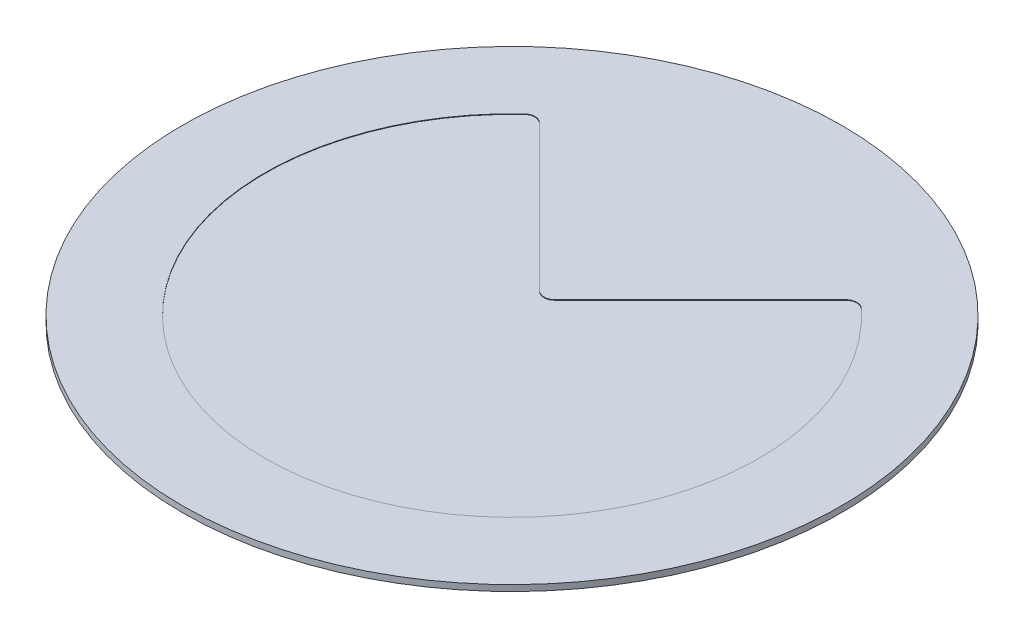
from build123d import *

# Parameters (mm, degrees)
SKETCH1_R           = 60
BOSS_EXTRUDE1_DEPTH = 0.1
FILLET1_R           = 2
BOSS_EXTRUDE2_START = 1
SKETCH2_R           = 60
BOSS_EXTRUDE2_DEPTH = 1


with BuildPart() as part:
    # Sketch1 → Boss-Extrude1 (new body)
    with BuildSketch(Plane(origin=(0, 0, 0), x_dir=(1, 0, 0), z_dir=(0, 1, 0))):
        Circle(SKETCH1_R)
        with BuildLine():
            Line((-29.221443851, 34.221443851), (0, 5))
            Line((0, 5), (29.221443851, 34.221443851))
            ThreePointArc((29.221443851, 34.221443851), (0, -45), (-29.221443851, 34.221443851))
        make_face(mode=Mode.SUBTRACT)
    extrude(amount=BOSS_EXTRUDE1_DEPTH)

    # Fillet1
    fillet1_edges = [part.edges().sort_by_distance(p)[0] for p in [
        (-29.221443851, 0.05, -34.221443851),
        (29.221443851, 0.05, -34.221443851),
        (0, 0.05, -5),
    ]]
    fillet(fillet1_edges, radius=FILLET1_R)

    # Sketch2 → Boss-Extrude2 (add)
    with BuildSketch(Plane.XZ.offset(BOSS_EXTRUDE2_START)):
        Circle(SKETCH2_R)
    extrude(amount=-BOSS_EXTRUDE2_DEPTH)


solid = part.part
